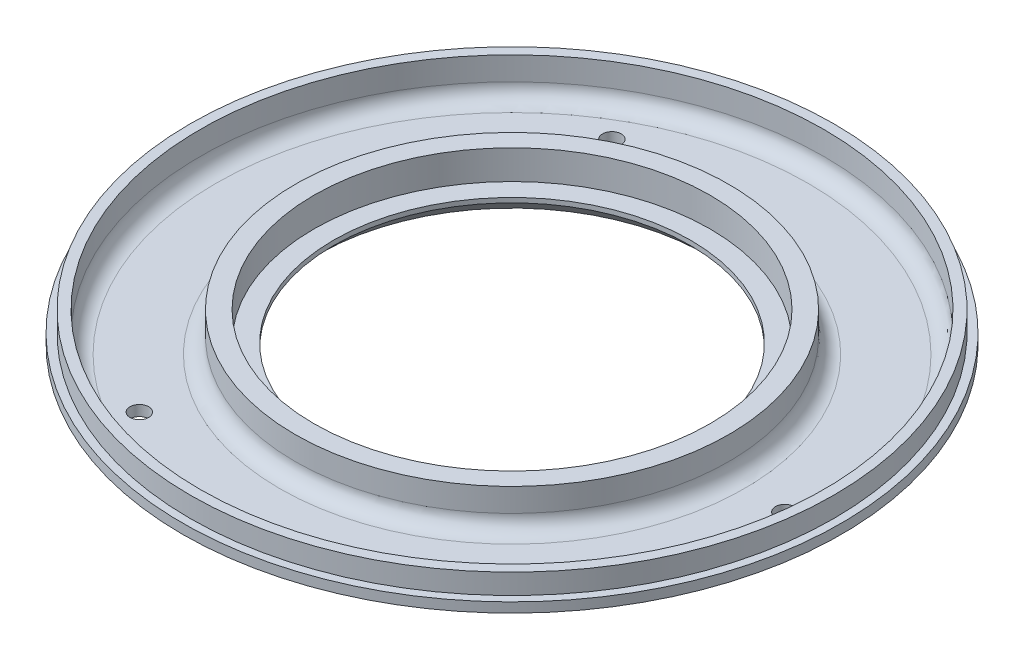
from build123d import *

# Parameters (mm, degrees)
F_90_0_0087_DIAMETER_HOLE1_D = 0.22098
CIRPATTERN3_COUNT            = 3
SKETCH8_R                    = 80.01
SKETCH8_R_2                  = 55.626
CUT_EXTRUDE1_DEPTH           = 10
FILLET5_R                    = 4
CHAMFER1_SIZE                = 4
BOSS_EXTRUDE1_START          = -7.5
SKETCH10_R                   = 84.55
SKETCH10_R_2                 = 82.55
BOSS_EXTRUDE1_DEPTH          = 7.5
CHAMFER3_SIZE                = 5
CHAMFER3_SIZE2               = 8.660254038
FILLET4_R                    = 5
F_12_0_189_DIAMETER_HOLE1_D  = 4.8006
CIRPATTERN5_COUNT            = 3


with BuildPart() as part:
    # Sketch2 → Revolve1 (revolve)
    with BuildSketch(Plane(origin=(0, 0, 0), x_dir=(0, 0, -1), z_dir=(1, 0, 0))):
        Polygon((-45.8, 0), (-82.55, 0), (-82.55, 12.7), (-50.8, 12.7), (-50.8, 5.2), (-45.8, 5.2), align=None)
    revolve(axis=Axis((0, -0.900399161, 0), (0, 1, 0)))

    # #90 (0.0087) Diameter Hole1 (through all)
    with Locations(Plane(origin=(0, 12.7, 0), x_dir=(1, 0, 0), z_dir=(0, 1, 0))):
        with Locations((-35, 60.621778265)):
            f_90_0_0087_diameter_hole1 = Hole(F_90_0_0087_DIAMETER_HOLE1_D / 2)

    # CirPattern3: #90 (0.0087) Diameter Hole1 ×3 about axis
    cirpattern3_axis = Axis((0, -0.900399161, 0), (0, 1, 0))
    for i in range(1, CIRPATTERN3_COUNT):
        add(f_90_0_0087_diameter_hole1.rotate(cirpattern3_axis, i * 360 / CIRPATTERN3_COUNT), mode=Mode.SUBTRACT)

    # Sketch8 → Cut-Extrude1 (cut)
    with BuildSketch(Plane(origin=(0, 12.7, 0), x_dir=(1, 0, 0), z_dir=(0, 1, 0))):
        Circle(SKETCH8_R)
        Circle(SKETCH8_R_2, mode=Mode.SUBTRACT)
    extrude(amount=-CUT_EXTRUDE1_DEPTH, mode=Mode.SUBTRACT)

    # Fillet5
    fillet5_edges = [part.edges().sort_by_distance(p)[0] for p in [
        (-55.626, 2.7, 0),
        (-80.01, 2.7, 0),
    ]]
    fillet(fillet5_edges, radius=FILLET5_R)

    # Chamfer1
    chamfer1_edges = [part.edges().sort_by_distance(p)[0] for p in [
        (0, 0, -45.8),
    ]]
    chamfer(chamfer1_edges, length=CHAMFER1_SIZE)

    # Sketch10 → Boss-Extrude1 (add)
    with BuildSketch(Plane.XZ.offset(BOSS_EXTRUDE1_START)):
        Circle(SKETCH10_R)
        Circle(SKETCH10_R_2, mode=Mode.SUBTRACT)
    extrude(amount=BOSS_EXTRUDE1_DEPTH)

    # Chamfer3
    chamfer3_edges = [part.edges().sort_by_distance(p)[0] for p in [
        (-84.55, 0, 0),
    ]]
    chamfer3_side = [part.faces().sort_by_distance(p)[0] for p in [
        (-84.55, 3.75, 0),
    ]]
    chamfer(chamfer3_edges, length=CHAMFER3_SIZE, length2=CHAMFER3_SIZE2, reference=chamfer3_side[0])

    # Fillet4
    fillet4_edges = [part.edges().sort_by_distance(p)[0] for p in [
        (-75.889745962, 0, 0),
    ]]
    fillet(fillet4_edges, radius=FILLET4_R)

    # #12 (0.189) Diameter Hole1 (through all)
    with Locations(Plane(origin=(0, 0, 0), x_dir=(-1, 0, 0), z_dir=(0, -1, 0))):
        with Locations((35, 60.621778265)):
            f_12_0_189_diameter_hole1 = Hole(F_12_0_189_DIAMETER_HOLE1_D / 2)

    # CirPattern5: #12 (0.189) Diameter Hole1 ×3 about axis
    cirpattern5_axis = Axis((0, -0.900399161, 0), (0, 1, 0))
    for i in range(1, CIRPATTERN5_COUNT):
        add(f_12_0_189_diameter_hole1.rotate(cirpattern5_axis, i * 360 / CIRPATTERN5_COUNT), mode=Mode.SUBTRACT)


solid = part.part
